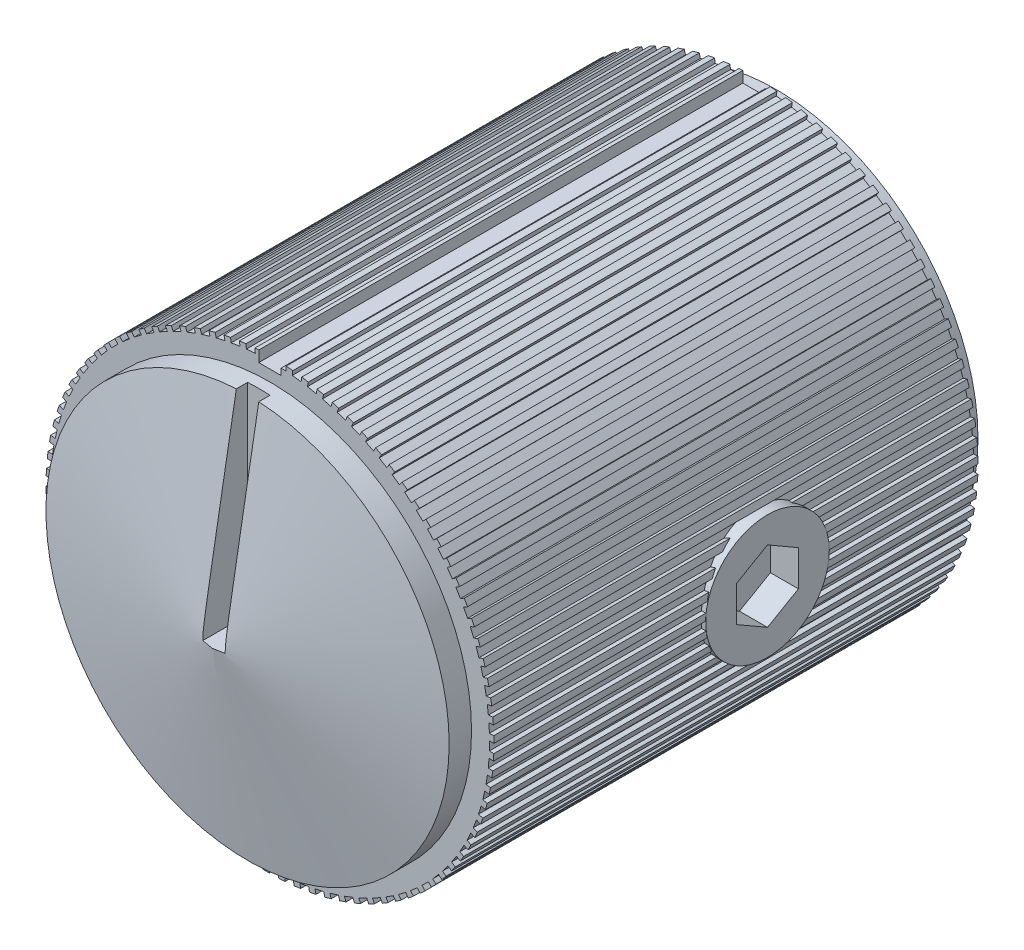
from build123d import *

# Parameters (mm, degrees)
CUT_EXTRUDE2_REACH      = 23.393
CUT_EXTRUDE2_END_RADIUS = 3.175
SKETCH15_R              = 1.7526
SKETCH16_R              = 1.7526
EXTRUDE1_DEPTH          = 3.175
CUT_EXTRUDE3_DEPTH      = 0.79375
SKETCH19_W              = 0.635
SKETCH19_H              = 6.057787336
CUT_EXTRUDE4_DEPTH      = 18.798586785
SKETCH20_W              = 0.635
SKETCH20_H              = 6.0325
CUT_EXTRUDE5_DEPTH      = 1.325209
CUT_EXTRUDE6_DEPTH      = 13.724291305
CIRPATTERN3_COUNT       = 90


with BuildPart() as part:
    # Sketch5 → Revolve3 (revolve)
    with BuildSketch(Plane(origin=(0, 0, 0), x_dir=(0, 0, -1), z_dir=(1, 0, 0)), mode=Mode.PRIVATE) as revolve3_sk:
        Polygon((-16.002, 0), (-14.994291305, 5.715), (-14.359291305, 5.715), (-14.359291305, 6.35), (-0.635, 6.35), (-0.635, 5.715), (0, 5.715), (0, 4.7625), (-4.7625, 4.7625), (-4.7625, 3.175), (-13.208, 3.175), (-13.208, 0), align=None)
    revolve(revolve3_sk.sketch.rotate(Axis((0, 0, 16.002), (0, 0, -1)), 90), axis=Axis((0, 0, 16.002), (0, 0, -1)))

    # Cut-Extrude2: up to this cylinder (the profile starts outside it)
    cut_extrude2_end = Plane(origin=(0, 0, 6.604), z_dir=(0, 0, 1)) * Cylinder(CUT_EXTRUDE2_END_RADIUS, 54.136, mode=Mode.PRIVATE)
    # Sketch15 → Cut-Extrude2 (cut, up to the surface)
    with BuildSketch(Plane(origin=(6.35, 0, 0), x_dir=(0, 0, -1), z_dir=(1, 0, 0)), mode=Mode.PRIVATE) as cut_extrude2_sk1:
        with Locations((-6.604, 0)):
            Circle(SKETCH15_R)
    cut_extrude2_tool1 = extrude(cut_extrude2_sk1.sketch, amount=-CUT_EXTRUDE2_REACH, mode=Mode.PRIVATE) - cut_extrude2_end
    add(cut_extrude2_tool1.solids().sort_by_distance((6.35, 0, 6.604))[0], mode=Mode.SUBTRACT)

    # Sketch19 → Cut-Extrude4 (cut, through all)
    with BuildSketch(Plane(origin=(0, 0, 0.635), x_dir=(-1, 0, 0), z_dir=(0, 0, -1))):
        with Locations((0, 9.061393668)):
            Rectangle(SKETCH19_W, SKETCH19_H)
    extrude(amount=-CUT_EXTRUDE4_DEPTH, mode=Mode.SUBTRACT)

    # Sketch20 → Cut-Extrude5 (cut)
    with BuildSketch(Plane.XY.offset(16.002)):
        with Locations((0, 3.01625)):
            Rectangle(SKETCH20_W, SKETCH20_H)
    extrude(amount=-CUT_EXTRUDE5_DEPTH, mode=Mode.SUBTRACT)

    # Sketch21 → Cut-Extrude6 (cut)
    with BuildSketch(Plane(origin=(0, 0, 0.635), x_dir=(-1, 0, 0), z_dir=(0, 0, -1))):
        Polygon((0.927138484, 12.054402947), (0.41585346, 6.210388386), (0.668886914, 6.188250827), (1.180171937, 12.032265388), align=None)
    cut_extrude6 = extrude(amount=-CUT_EXTRUDE6_DEPTH, mode=Mode.SUBTRACT)

    # CirPattern3: Cut-Extrude6 ×90 about axis
    cirpattern3_axis = Axis((0, 0, 0), (0, 0, 1))
    for i in range(1, CIRPATTERN3_COUNT):
        add(cut_extrude6.rotate(cirpattern3_axis, i * 360 / CIRPATTERN3_COUNT), mode=Mode.SUBTRACT)


with BuildPart() as body_2:
    # Sketch16 → Extrude1 (new body)
    with BuildSketch(Plane(origin=(6.35, 0, 0), x_dir=(0, 0, -1), z_dir=(1, 0, 0))):
        with Locations((-6.604, 0)):
            Circle(SKETCH16_R)
    extrude(amount=-EXTRUDE1_DEPTH)

    # Sketch17 → Cut-Extrude3 (cut)
    with BuildSketch(Plane(origin=(6.35, 0, 0), x_dir=(0, 0, -1), z_dir=(1, 0, 0))):
        Polygon((-6.604, 1.011864082), (-7.4803, 0.505932041), (-7.4803, -0.505932041), (-6.604, -1.011864082), (-5.7277, -0.505932041), (-5.7277, 0.505932041), align=None)
    extrude(amount=-CUT_EXTRUDE3_DEPTH, mode=Mode.SUBTRACT)


solid = Compound([part.part, body_2.part])
